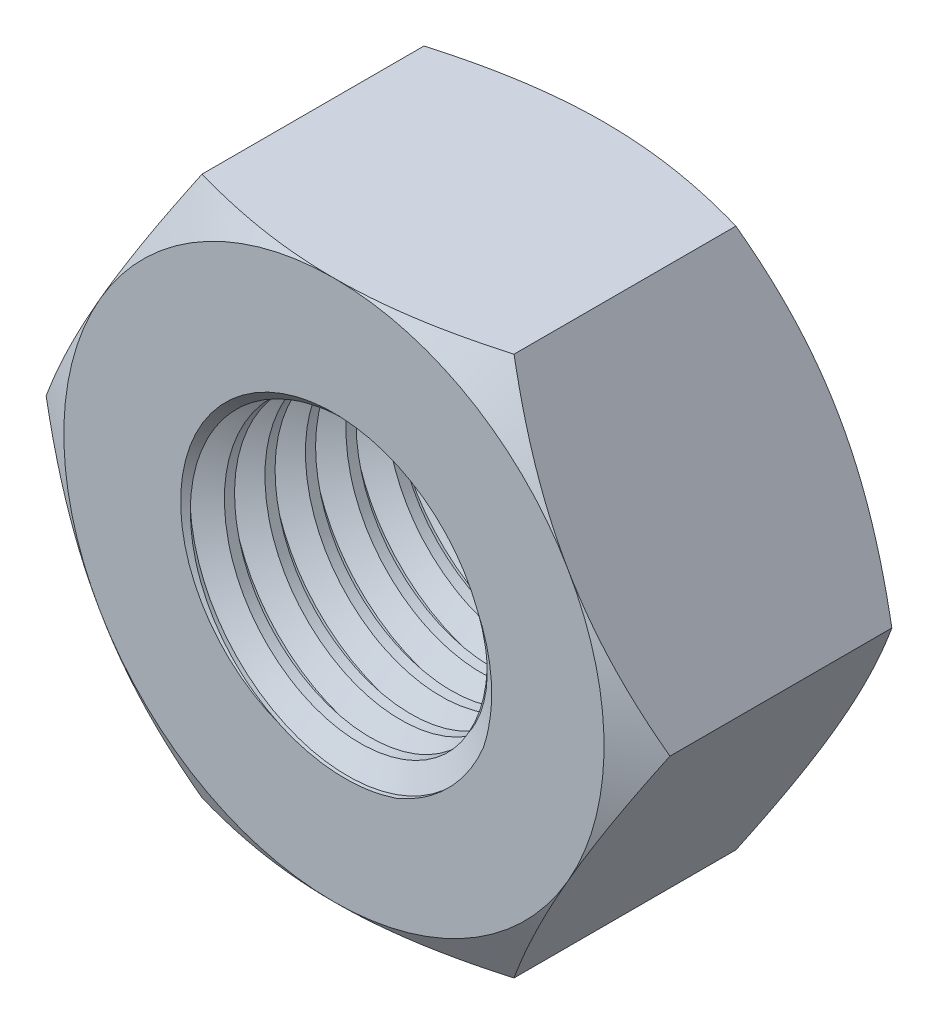
from build123d import *

# Parameters (mm, degrees)
BOSS_EXTRUDE1_DEPTH = 5
CUT_EXTRUDE1_REACH  = 20.257
SKETCH3_R           = 5.175
CHAMFER1_SIZE       = 0.5
THREAD2_PITCH       = 1.5


with BuildPart() as part:
    # Sketch1 → Boss-Extrude1 (new, symmetric)
    with BuildSketch(Plane.XY):
        Polygon((11.547005384, 0), (5.773502692, 10), (-5.773502692, 10), (-11.547005384, 0), (-5.773502692, -10), (5.773502692, -10), align=None)
    extrude(amount=BOSS_EXTRUDE1_DEPTH, both=True)

    # Sketch2 → Cut-Revolve1 (revolve, cut)
    with BuildSketch(Plane(origin=(0, 0, 0), x_dir=(0, 0, -1), z_dir=(1, 0, 0))):
        Polygon((-5, 10), (-5, 13), (-3.267949192, 13), align=None)
    cut_revolve1 = revolve(axis=Axis((0, 0, 0), (0, 0, -1)), mode=Mode.SUBTRACT)

    # Mirror1: Cut-Revolve1 across plane
    add(cut_revolve1.mirror(Plane.XY), mode=Mode.SUBTRACT)

    # Sketch3 → Cut-Extrude1 (cut, up to next)
    with BuildSketch(Plane.XY.offset(5), mode=Mode.PRIVATE) as cut_extrude1_sk1:
        Circle(SKETCH3_R)
    cut_extrude1_tool1 = extrude(cut_extrude1_sk1.sketch, amount=-CUT_EXTRUDE1_REACH, mode=Mode.PRIVATE) & part.part
    add(cut_extrude1_tool1.solids().sort_by_distance((0, 0, 5))[0], mode=Mode.SUBTRACT)

    # Chamfer1
    chamfer1_edges = [part.edges().sort_by_distance(p)[0] for p in [
        (-5.175, 0, 5),
        (-5.175, 0, -5),
    ]]
    chamfer(chamfer1_edges, length=CHAMFER1_SIZE)

    # Thread2: the profile of Thread Profile2 profile screwed along a right-hand helix of 14.666667 turns, 8 arcs to a turn; built about Z, then put on its axis
    thread2_z = Axis((0, 0, 0), (0, 0, 1))
    thread2_corners = [(5.1747, 0, -0.000173205), (5.986898812, 0, 0.468749998), (5.986898812, 0, 0.656249998), (5.1747, 0, 1.125173201)]
    with BuildLine(mode=Mode.PRIVATE) as thread2_profile:
        Line(thread2_corners[0], thread2_corners[1])
        Line(thread2_corners[1], thread2_corners[2])
        Line(thread2_corners[2], thread2_corners[3])
        Line(thread2_corners[3], thread2_corners[0])
    thread2_cap = Face(thread2_profile.wire())
    thread2_turn_angles = [0, 22.5, 45, 67.5, 90, 112.5, 135, 157.5, 180, 202.5, 225, 247.5, 270, 292.5, 315, 337.5, 360]
    thread2_turn_weights = [1, 0.9238795325112867, 1, 0.9238795325112867, 1, 0.9238795325112867, 1, 0.9238795325112867, 1, 0.9238795325112867, 1, 0.9238795325112867, 1, 0.9238795325112867, 1, 0.9238795325112867, 1]
    thread2_turn_rails = [Edge.make_bspline([Vector(p[0], p[1], 0).rotate(thread2_z, thread2_turn_angles[k]) / thread2_turn_weights[k] + Vector(0, 0, p[2] + THREAD2_PITCH * thread2_turn_angles[k] / 360) for k in range(17)], [0, 0, 0, 1, 1, 2, 2, 3, 3, 4, 4, 5, 5, 6, 6, 7, 7, 8, 8, 8], 2, thread2_turn_weights) for p in thread2_corners]
    thread2_turn_sides = [Face.make_surface_from_curves(thread2_turn_rails[p[0]], thread2_turn_rails[p[1]]) for p in [(0, 1), (1, 2), (2, 3), (3, 0)]]
    thread2_last_angles = [5040, 5062.5, 5085, 5107.5, 5130, 5152.5, 5175, 5197.5, 5220, 5242.5, 5265, 5272.5, 5280]
    thread2_last_weights = [1, 0.9238795325112867, 1, 0.9238795325112867, 1, 0.9238795325112867, 1, 0.9238795325112867, 1, 0.9238795325112867, 1, 0.9914448613738135, 1]
    thread2_last_rails = [Edge.make_bspline([Vector(p[0], p[1], 0).rotate(thread2_z, thread2_last_angles[k]) / thread2_last_weights[k] + Vector(0, 0, p[2] + THREAD2_PITCH * thread2_last_angles[k] / 360) for k in range(13)], [0, 0, 0, 1, 1, 2, 2, 3, 3, 4, 4, 5, 5, 6, 6, 6], 2, thread2_last_weights) for p in thread2_corners]
    thread2_last_sides = [Face.make_surface_from_curves(thread2_last_rails[p[0]], thread2_last_rails[p[1]]) for p in [(0, 1), (1, 2), (2, 3), (3, 0)]]
    thread2 = Plane(origin=(0, 0, 6.5), x_dir=(-1, 0, 0), z_dir=(0, 0, -1)) * Solid(Shell([*[p.moved(Location((0, 0, THREAD2_PITCH * i))) for i in range(14) for p in thread2_turn_sides], *thread2_last_sides, thread2_cap, thread2_cap.rotate(thread2_z, 5280).moved(Location((0, 0, THREAD2_PITCH * 5280 / 360)))]))
    add(thread2, mode=Mode.SUBTRACT)


solid = part.part
